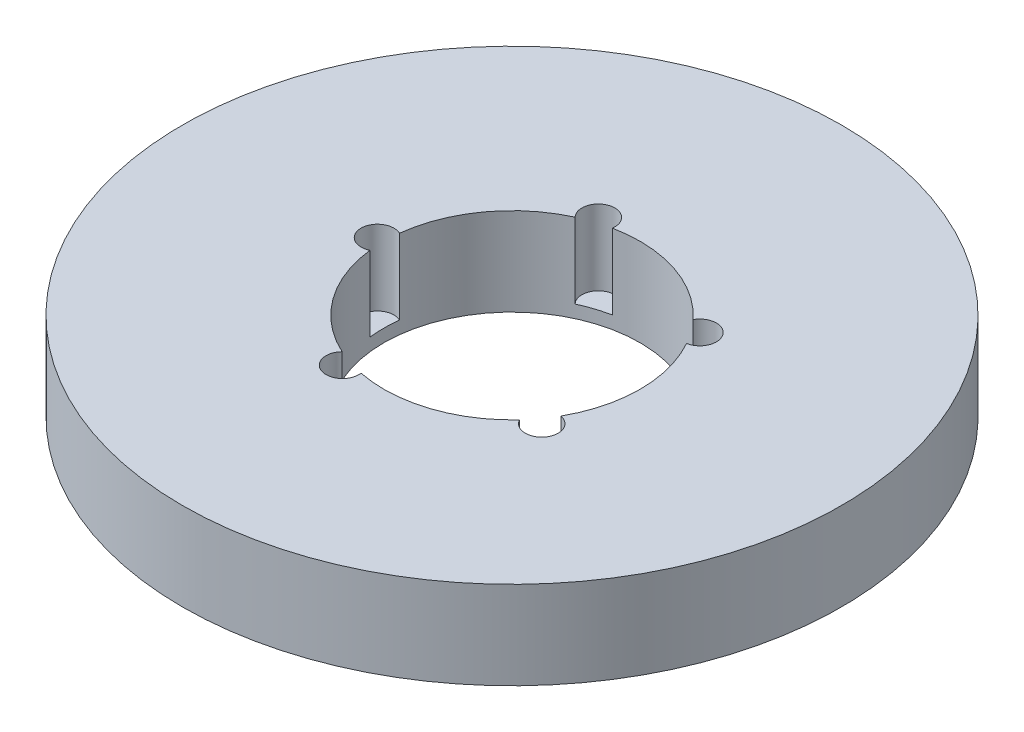
from build123d import *

# Parameters (mm, degrees)
SKETCH1_R           = 90
BOSS_EXTRUDE1_DEPTH = 24
SKETCH2_R           = 35
CUT_EXTRUDE1_DEPTH  = 130.52219887
SKETCH3_R           = 4.490526197
CUT_EXTRUDE2_DEPTH  = 20.537844313
CIRPATTERN1_COUNT   = 5


with BuildPart() as part:
    # Sketch1 → Boss-Extrude1 (new body)
    with BuildSketch(Plane(origin=(0, 0, 0), x_dir=(1, 0, 0), z_dir=(0, 1, 0))):
        Circle(SKETCH1_R)
    extrude(amount=BOSS_EXTRUDE1_DEPTH)

    # Sketch2 → Cut-Extrude1 (cut, through all)
    with BuildSketch(Plane(origin=(0, 0, 0), x_dir=(1, 0, 0), z_dir=(0, 1, 0))):
        Circle(SKETCH2_R)
    extrude(amount=CUT_EXTRUDE1_DEPTH, mode=Mode.SUBTRACT)

    # Sketch3 → Cut-Extrude2 (cut)
    with BuildSketch(Plane(origin=(0, 24, 0), x_dir=(1, 0, 0), z_dir=(0, 1, 0))):
        with Locations((-36.737499638, 0)):
            Circle(SKETCH3_R)
    cut_extrude2 = extrude(amount=-CUT_EXTRUDE2_DEPTH, mode=Mode.SUBTRACT)

    # CirPattern1: Cut-Extrude2 ×5 about axis
    cirpattern1_axis = Axis((0, 0, 0), (0, 1, 0))
    for i in range(1, CIRPATTERN1_COUNT):
        add(cut_extrude2.rotate(cirpattern1_axis, i * 360 / CIRPATTERN1_COUNT), mode=Mode.SUBTRACT)


solid = part.part
